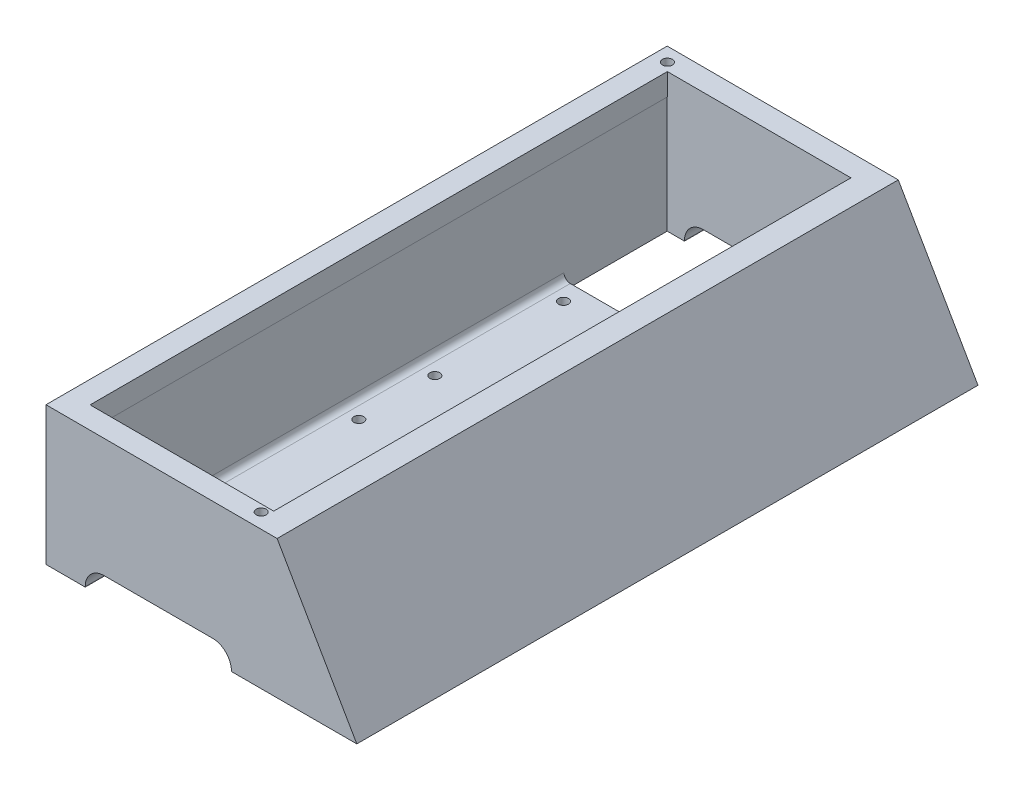
from build123d import *

# Parameters (mm, degrees)
BOSS_EXTRUDE1_DEPTH = 198
SHELL1_T            = -7
SKETCH2_W           = 184
SKETCH2_H           = 91.833810452
CUT_EXTRUDE1_DEPTH  = 10
SKETCH3_W           = 51.015734787
SKETCH3_H           = 184
CUT_EXTRUDE3_DEPTH  = 10
SKETCH4_W           = 43.227096231
SKETCH4_H           = 118.22
SKETCH4_W_2         = 10
SKETCH4_H_2         = 10
BOSS_EXTRUDE2_DEPTH = 3
SKETCH6_R           = 1.585
CUT_EXTRUDE5_DEPTH  = 10
SKETCH10_R          = 1.585
CUT_EXTRUDE8_DEPTH  = 5
SKETCH9_W           = 46.592666587
SKETCH9_H           = 6.179476357
CUT_EXTRUDE7_DEPTH  = 10
FILLET1_R           = 6
FILLET2_R           = 6
SKETCH11_R          = 1.585
CUT_EXTRUDE9_DEPTH  = 5
SKETCH12_R          = 1.585
CUT_EXTRUDE10_DEPTH = 5
FILLET3_R           = 5
FILLET4_R           = 1
FILLET5_R           = 2


with BuildPart() as part:
    # Sketch1 → Boss-Extrude1 (new body)
    with BuildSketch(Plane.XY):
        Polygon((0, 0), (99.07, 0), (73.665, 44.002750766), (0, 44.1), align=None)
    extrude(amount=BOSS_EXTRUDE1_DEPTH)

    # Shell1
    shell1_openings = [part.faces().sort_by_distance(p)[0] for p in [
        (49.535, 0, 99),
    ]]
    offset(amount=SHELL1_T, openings=shell1_openings, kind=Kind.INTERSECTION)

    # Sketch2 → Cut-Extrude1 (cut)
    with BuildSketch(Plane(origin=(68.240322174, 39.398568376, 0), x_dir=(0, 0, 1), z_dir=(-0.866025403784436, -0.5000000000000048, 0))):
        with Locations((99, 0.42335711)):
            Rectangle(SKETCH2_W, SKETCH2_H)
    extrude(amount=CUT_EXTRUDE1_DEPTH, mode=Mode.SUBTRACT)

    # Sketch3 → Cut-Extrude3 (cut)
    with BuildSketch(Plane(origin=(0.058218743, 44.099923142, 0), x_dir=(0.9999991285962467, -0.001320154061894519, 0), z_dir=(0.001320154061894519, 0.9999991285962467, 0))):
        with Locations((32.507861294, -99)):
            Rectangle(SKETCH3_W, SKETCH3_H)
    extrude(amount=-CUT_EXTRUDE3_DEPTH, mode=Mode.SUBTRACT)

    # Sketch4 → Boss-Extrude2 (add)
    with BuildSketch(Plane.XZ):
        with Locations((28.613548116, 99)):
            Rectangle(SKETCH4_W, SKETCH4_H)
        with Locations((85.987096231, 86)):
            Rectangle(SKETCH4_W_2, SKETCH4_H_2)
    boss_extrude2 = extrude(amount=-BOSS_EXTRUDE2_DEPTH)

    # Sketch6 → Cut-Extrude5 (cut)
    with BuildSketch(Plane(origin=(0, 3, 0), x_dir=(1, 0, 0), z_dir=(0, 1, 0))):
        with Locations((12.830469551, -45.887182752)):
            Circle(SKETCH6_R)
        with Locations((12.830469551, -86.887182752)):
            Circle(SKETCH6_R)
        with Locations((12.830469551, -111.112817248)):
            Circle(SKETCH6_R)
        with Locations((12.830469551, -152.112817248)):
            Circle(SKETCH6_R)
    extrude(amount=-CUT_EXTRUDE5_DEPTH, mode=Mode.SUBTRACT)

    # Sketch10 → Cut-Extrude8 (cut)
    with BuildSketch(Plane.XZ):
        with Locations((84.092666587, 85.739056505)):
            Circle(SKETCH10_R)
    cut_extrude8 = extrude(amount=-CUT_EXTRUDE8_DEPTH, mode=Mode.SUBTRACT)

    # Sketch9 → Cut-Extrude7 (cut)
    with BuildSketch(Plane.XY.offset(198)):
        with Locations((35.796333293, 3.089738179)):
            Rectangle(SKETCH9_W, SKETCH9_H)
    cut_extrude7 = extrude(amount=-CUT_EXTRUDE7_DEPTH, mode=Mode.SUBTRACT)

    # Mirror1: Cut-Extrude7 across plane
    add(cut_extrude7.mirror(Plane(origin=(0, 0, 99), x_dir=(1, 0, 0), z_dir=(0, 0, -1))), mode=Mode.SUBTRACT)

    # Fillet1
    fillet1_edges = [part.edges().sort_by_distance(p)[0] for p in [
        (12.5, 6.179476357, 3.5),
        (59.092666587, 6.179476357, 3.5),
    ]]
    fillet(fillet1_edges, radius=FILLET1_R)

    # Fillet2
    fillet2_edges = [part.edges().sort_by_distance(p)[0] for p in [
        (59.092666587, 6.179476357, 194.5),
        (12.5, 6.179476357, 194.5),
    ]]
    fillet(fillet2_edges, radius=FILLET2_R)

    # Mirror2: Boss-Extrude2, Cut-Extrude8 across plane
    add(boss_extrude2.mirror(Plane(origin=(0, 0, 99), x_dir=(1, 0, 0), z_dir=(0, 0, -1))))
    add(cut_extrude8.mirror(Plane(origin=(0, 0, 99), x_dir=(1, 0, 0), z_dir=(0, 0, -1))), mode=Mode.SUBTRACT)

    # Sketch11 → Cut-Extrude9 (cut)
    with BuildSketch(Plane.XZ):
        with Locations((12.830469551, 152.112817248)):
            Circle(SKETCH11_R)
        with Locations((12.830469551, 111.112817248)):
            Circle(SKETCH11_R)
        with Locations((12.830469551, 86.887182752)):
            Circle(SKETCH11_R)
        with Locations((12.830469551, 45.887182752)):
            Circle(SKETCH11_R)
    extrude(amount=-CUT_EXTRUDE9_DEPTH, mode=Mode.SUBTRACT)

    # Sketch12 → Cut-Extrude10 (cut)
    with BuildSketch(Plane(origin=(0.058218743, 44.099923142, 0), x_dir=(0.9999991285962467, -0.001320154061894519, 0), z_dir=(0.001320154061894519, 0.9999991285962467, 0))):
        with Locations((63.768297777, -193.245706001)):
            Circle(SKETCH12_R)
        with Locations((4.416986766, -4.402159503)):
            Circle(SKETCH12_R)
    extrude(amount=-CUT_EXTRUDE10_DEPTH, mode=Mode.SUBTRACT)

    # Fillet3
    fillet3_edges = [part.edges().sort_by_distance(p)[0] for p in [
        (90.121070828, 1.5, 117),
        (90.121070828, 1.5, 107),
        (90.121070828, 1.5, 91),
        (90.121070828, 1.5, 81),
    ]]
    fillet(fillet3_edges, radius=FILLET3_R)

    # Fillet4
    fillet4_edges = [part.edges().sort_by_distance(p)[0] for p in [
        (89.255045424, 3, 112),
        (89.255045424, 3, 86),
    ]]
    fillet(fillet4_edges, radius=FILLET4_R)

    # Fillet5
    fillet5_edges = [part.edges().sort_by_distance(p)[0] for p in [
        (7, 3, 99),
    ]]
    fillet(fillet5_edges, radius=FILLET5_R)


solid = part.part
